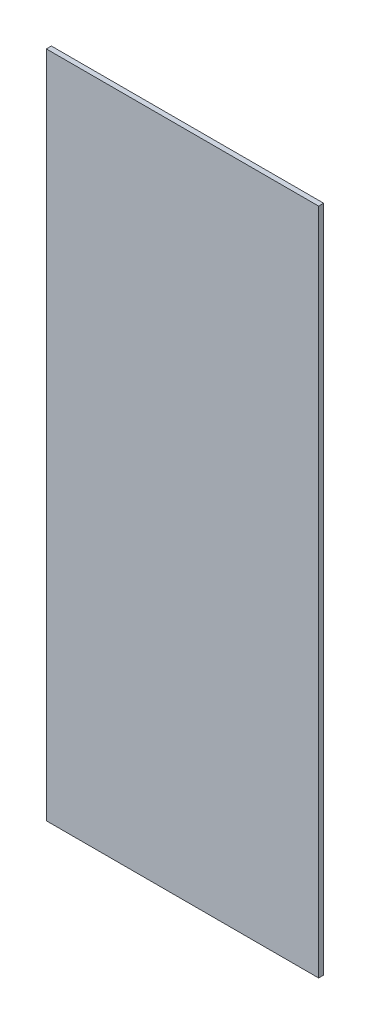
from build123d import *

# Parameters (mm, degrees)
SKETCH1_W           = 108.35
SKETCH1_H           = 266
BOSS_EXTRUDE1_DEPTH = 2


with BuildPart() as part:
    # Sketch1 → Boss-Extrude1 (new body)
    with BuildSketch(Plane.XY):
        with Locations((54.175, -133)):
            Rectangle(SKETCH1_W, SKETCH1_H)
    extrude(amount=BOSS_EXTRUDE1_DEPTH)


solid = part.part
